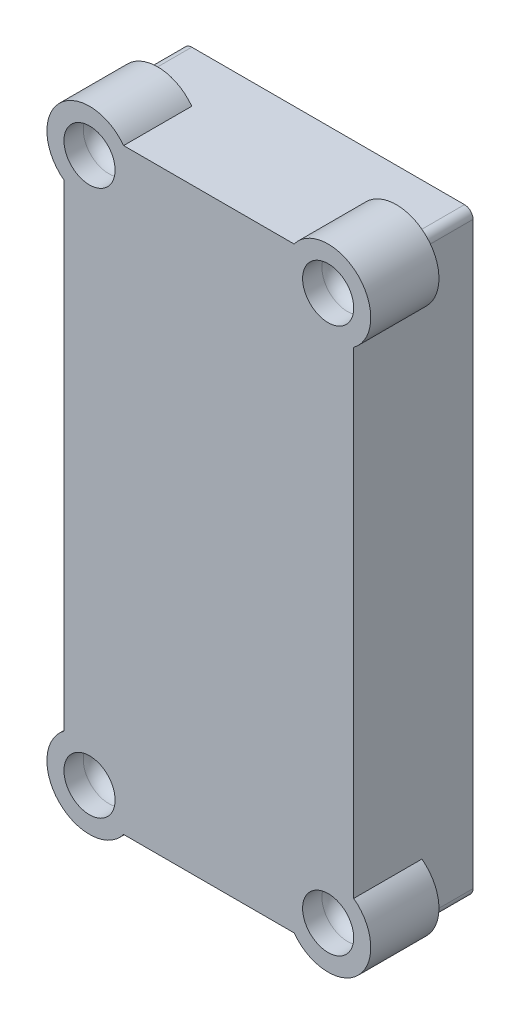
from build123d import *

# Parameters (mm, degrees)
SKETCH1_W           = 34
SKETCH1_H           = 70
BOSS_EXTRUDE1_DEPTH = 14
SKETCH2_W           = 30
SKETCH2_H           = 66
CUT_EXTRUDE1_DEPTH  = 12
SKETCH3_R           = 3
BOSS_EXTRUDE2_DEPTH = 12
SKETCH4_R           = 2
CUT_EXTRUDE2_DEPTH  = 80.069589603
CUT_EXTRUDE4_REACH  = 81.07
SKETCH6_R           = 2.5
SKETCH6_R_2         = 2
FILLET1_R           = 1
BOSS_EXTRUDE3_START = -8
SKETCH7_R           = 5
SKETCH7_R_2         = 3
BOSS_EXTRUDE3_DEPTH = 8
CUT_EXTRUDE7_START  = -4
SKETCH8_R           = 3
CUT_EXTRUDE7_DEPTH  = 4
FILLET2_R           = 2


with BuildPart() as part:
    # Sketch1 → Boss-Extrude1 (new body)
    with BuildSketch(Plane.XY):
        with Locations((17, 35)):
            Rectangle(SKETCH1_W, SKETCH1_H)
    extrude(amount=BOSS_EXTRUDE1_DEPTH)

    # Sketch2 → Cut-Extrude1 (cut)
    with BuildSketch(Plane(origin=(0, 0, 0), x_dir=(-1, 0, 0), z_dir=(0, 0, -1))):
        with Locations((-17, 35)):
            Rectangle(SKETCH2_W, SKETCH2_H)
    extrude(amount=-CUT_EXTRUDE1_DEPTH, mode=Mode.SUBTRACT)

    # Sketch3 → Boss-Extrude2 (add)
    with BuildSketch(Plane(origin=(0, 0, 0), x_dir=(-1, 0, 0), z_dir=(0, 0, -1))):
        with Locations((-31, 67)):
            Circle(SKETCH3_R)
        with Locations((-3, 67)):
            Circle(SKETCH3_R)
        with Locations((-3, 3)):
            Circle(SKETCH3_R)
        with Locations((-31, 3)):
            Circle(SKETCH3_R)
    extrude(amount=-BOSS_EXTRUDE2_DEPTH)

    # Sketch4 → Cut-Extrude2 (cut, through all)
    with BuildSketch(Plane(origin=(0, 0, 0), x_dir=(-1, 0, 0), z_dir=(0, 0, -1))):
        with Locations((-3, 67)):
            Circle(SKETCH4_R)
        with Locations((-31, 67)):
            Circle(SKETCH4_R)
        with Locations((-3, 3)):
            Circle(SKETCH4_R)
        with Locations((-31, 3)):
            Circle(SKETCH4_R)
    extrude(amount=-CUT_EXTRUDE2_DEPTH, mode=Mode.SUBTRACT)

    # Sketch6 → Cut-Extrude4 (cut, up to next)
    with BuildSketch(Plane.XZ, mode=Mode.PRIVATE) as cut_extrude4_sk1:
        with Locations((9.5, 0)):
            Circle(SKETCH6_R)
    cut_extrude4_tool1 = extrude(cut_extrude4_sk1.sketch, amount=-CUT_EXTRUDE4_REACH, mode=Mode.PRIVATE) & part.part
    # Sketch6 → Cut-Extrude4 (cut, up to next)
    with BuildSketch(Plane.XZ, mode=Mode.PRIVATE) as cut_extrude4_sk2:
        with Locations((24.5, 0)):
            Circle(SKETCH6_R_2)
    cut_extrude4_tool2 = extrude(cut_extrude4_sk2.sketch, amount=-CUT_EXTRUDE4_REACH, mode=Mode.PRIVATE) & part.part
    add(cut_extrude4_tool1.solids().sort_by_distance((9.5, 0, 0))[0], mode=Mode.SUBTRACT)
    add(cut_extrude4_tool2.solids().sort_by_distance((24.5, 0, 0))[0], mode=Mode.SUBTRACT)

    # Fillet1
    fillet1_edges = [part.edges().sort_by_distance(p)[0] for p in [
        (0, 70, 7),
        (34, 70, 7),
        (34, 0, 7),
        (0, 0, 7),
    ]]
    fillet(fillet1_edges, radius=FILLET1_R)

    # Sketch7 → Boss-Extrude3 (add)
    # profile 1 of 4: a face of its own
    with BuildSketch(Plane.XY.offset(14).offset(BOSS_EXTRUDE3_START)):
        with Locations((31, 67)):
            Circle(SKETCH7_R)
        with Locations((31, 67)):
            Circle(SKETCH7_R_2, mode=Mode.SUBTRACT)
    # profile 2 of 4: a face of its own
    with BuildSketch(Plane.XY.offset(14).offset(BOSS_EXTRUDE3_START)):
        with Locations((3, 67)):
            Circle(SKETCH7_R)
        with Locations((3, 67)):
            Circle(SKETCH7_R_2, mode=Mode.SUBTRACT)
    # profile 3 of 4: a face of its own
    with BuildSketch(Plane.XY.offset(14).offset(BOSS_EXTRUDE3_START)):
        with Locations((31, 3)):
            Circle(SKETCH7_R)
        with Locations((31, 3)):
            Circle(SKETCH7_R_2, mode=Mode.SUBTRACT)
    # profile 4 of 4: a face of its own
    with BuildSketch(Plane.XY.offset(14).offset(BOSS_EXTRUDE3_START)):
        with Locations((3, 3)):
            Circle(SKETCH7_R)
        with Locations((3, 3)):
            Circle(SKETCH7_R_2, mode=Mode.SUBTRACT)
    extrude(amount=BOSS_EXTRUDE3_DEPTH)

    # Sketch8 → Cut-Extrude7 (cut)
    with BuildSketch(Plane.XY.offset(14).offset(CUT_EXTRUDE7_START)):
        with Locations((3, 3)):
            Circle(SKETCH8_R)
        with Locations((31, 3)):
            Circle(SKETCH8_R)
        with Locations((31, 67)):
            Circle(SKETCH8_R)
        with Locations((3, 67)):
            Circle(SKETCH8_R)
    extrude(amount=CUT_EXTRUDE7_DEPTH, mode=Mode.SUBTRACT)

    # Fillet2
    # the kernel refuses this fillet: 2 mm, written as the material it adds along each edge
    with BuildSketch(Plane(origin=(3, 67, 10), x_dir=(1, 0, 0), z_dir=(0, -1, 0))) as fillet2_piece_1_section:
        with BuildLine():
            CenterArc((1, 1.732050808), FILLET2_R, 300, 60)
            Line((2, 0), (2.02, -0.034641016))
            ThreePointArc((2.02, -0.034641016), (2.5, -0.04), (3, -0.04))
            Line((3, -0.04), (3.04, 0))
            Line((3.04, 0), (3.04, 1.732050808))
            Line((3.04, 1.732050808), (3, 1.732050808))
        make_face()
    fillet2_piece_1 = revolve(axis=Axis((3, 67, 10), (0, 0, 1)), mode=Mode.PRIVATE)
    fillet2_piece_1 = fillet2_piece_1 - Plane(origin=(3, 67, 10.721085361), x_dir=(-1, 0, 0), z_dir=(0, 0, -1)) * Cylinder(2, 13, mode=Mode.PRIVATE)
    add(fillet2_piece_1)
    with BuildSketch(Plane(origin=(31, 67, 10), x_dir=(1, 0, 0), z_dir=(0, -1, 0))) as fillet2_piece_2_section:
        with BuildLine():
            CenterArc((1, 1.732050808), FILLET2_R, 300, 60)
            Line((2, 0), (2.02, -0.034641016))
            ThreePointArc((2.02, -0.034641016), (2.5, -0.04), (3, -0.04))
            Line((3, -0.04), (3.04, 0))
            Line((3.04, 0), (3.04, 1.732050808))
            Line((3.04, 1.732050808), (3, 1.732050808))
        make_face()
    fillet2_piece_2 = revolve(axis=Axis((31, 67, 10), (0, 0, 1)), mode=Mode.PRIVATE)
    fillet2_piece_2 = fillet2_piece_2 - Plane(origin=(31, 67, 10.721085361), x_dir=(-1, 0, 0), z_dir=(0, 0, -1)) * Cylinder(2, 13, mode=Mode.PRIVATE)
    add(fillet2_piece_2)
    with BuildSketch(Plane(origin=(31, 3, 10), x_dir=(1, 0, 0), z_dir=(0, -1, 0))) as fillet2_piece_3_section:
        with BuildLine():
            CenterArc((1, 1.732050808), FILLET2_R, 300, 60)
            Line((2, 0), (2.02, -0.034641016))
            ThreePointArc((2.02, -0.034641016), (2.5, -0.04), (3, -0.04))
            Line((3, -0.04), (3.04, 0))
            Line((3.04, 0), (3.04, 1.732050808))
            Line((3.04, 1.732050808), (3, 1.732050808))
        make_face()
    fillet2_piece_3 = revolve(axis=Axis((31, 3, 10), (0, 0, 1)), mode=Mode.PRIVATE)
    fillet2_piece_3 = fillet2_piece_3 - Plane(origin=(31, 3, 10.721085361), x_dir=(-1, 0, 0), z_dir=(0, 0, -1)) * Cylinder(2, 13, mode=Mode.PRIVATE)
    add(fillet2_piece_3)
    with BuildSketch(Plane(origin=(3, 3, 10), x_dir=(1, 0, 0), z_dir=(0, -1, 0))) as fillet2_piece_4_section:
        with BuildLine():
            CenterArc((1, 1.732050808), FILLET2_R, 300, 60)
            Line((2, 0), (2.02, -0.034641016))
            ThreePointArc((2.02, -0.034641016), (2.5, -0.04), (3, -0.04))
            Line((3, -0.04), (3.04, 0))
            Line((3.04, 0), (3.04, 1.732050808))
            Line((3.04, 1.732050808), (3, 1.732050808))
        make_face()
    fillet2_piece_4 = revolve(axis=Axis((3, 3, 10), (0, 0, 1)), mode=Mode.PRIVATE)
    fillet2_piece_4 = fillet2_piece_4 - Plane(origin=(3, 3, 10.721085361), x_dir=(-1, 0, 0), z_dir=(0, 0, -1)) * Cylinder(2, 13, mode=Mode.PRIVATE)
    add(fillet2_piece_4)


solid = part.part
